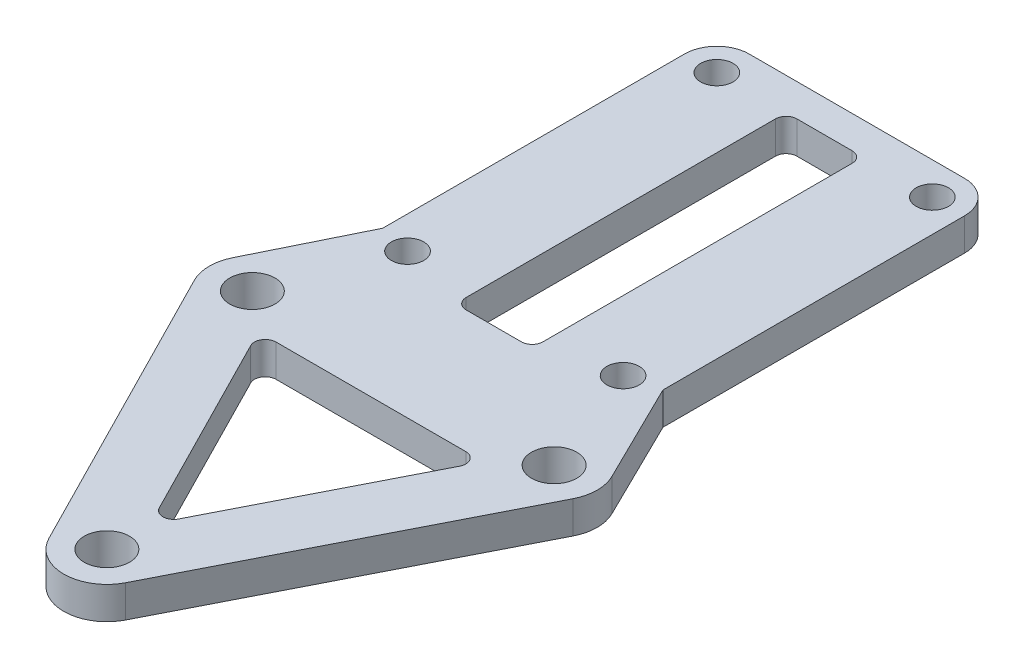
from build123d import *

# Parameters (mm, degrees)
SKETCH_1_R      = 2.1
SKETCH_1_R_2    = 1.5
EXTRUDE_1_DEPTH = 3


with BuildPart() as part:
    # 草图1 → 凸台-拉伸1 (new body)
    with BuildSketch(Plane(origin=(0, 0, 0), x_dir=(1, 0, 0), z_dir=(0, 1, 0))):
        with BuildLine():
            Line((-17.564652462, 25.685267837), (-3.564652462, -1.814732163))
            ThreePointArc((-3.564652462, -1.814732163), (0, -4), (3.564652462, -1.814732163))
            Line((3.564652462, -1.814732163), (17.564652462, 25.685267837))
            ThreePointArc((17.564652462, 25.685267837), (17.999904029, 27.472291527), (17.589451488, 29.265173649))
            Line((17.589451488, 29.265173649), (13, 38.597747519))
            Line((13, 38.597747519), (13, 66.6))
            ThreePointArc((13, 66.6), (12.121320344, 68.721320344), (10, 69.6))
            Line((10, 69.6), (-10, 69.6))
            ThreePointArc((-10, 69.6), (-12.121320344, 68.721320344), (-13, 66.6))
            Line((-13, 66.6), (-13, 38.597747519))
            Line((-13, 38.597747519), (-17.589451488, 29.265173649))
            ThreePointArc((-17.589451488, 29.265173649), (-17.999904029, 27.472291527), (-17.564652462, 25.685267837))
        make_face()
        with Locations((-14, 27.5)):
            Circle(SKETCH_1_R, mode=Mode.SUBTRACT)
        Circle(SKETCH_1_R, mode=Mode.SUBTRACT)
        with Locations((14, 27.5)):
            Circle(SKETCH_1_R, mode=Mode.SUBTRACT)
        with Locations((-10, 66.6)):
            Circle(SKETCH_1_R_2, mode=Mode.SUBTRACT)
        with Locations((10, 66.6)):
            Circle(SKETCH_1_R_2, mode=Mode.SUBTRACT)
        with Locations((-10, 37.9)):
            Circle(SKETCH_1_R_2, mode=Mode.SUBTRACT)
        with Locations((10, 37.9)):
            Circle(SKETCH_1_R_2, mode=Mode.SUBTRACT)
        with BuildLine():
            Line((-9.696306816, 23.046316959), (-0.891163116, 5.750498977))
            ThreePointArc((-0.891163116, 5.750498977), (0, 5.204182018), (0.891163116, 5.750498977))
            Line((0.891163116, 5.750498977), (9.696306816, 23.046316959))
            ThreePointArc((9.696306816, 23.046316959), (9.657693711, 24.022645654), (8.8051437, 24.5))
            Line((8.8051437, 24.5), (-8.8051437, 24.5))
            ThreePointArc((-8.8051437, 24.5), (-9.657693711, 24.022645654), (-9.696306816, 23.046316959))
        make_face(mode=Mode.SUBTRACT)
        with BuildLine():
            Line((-3.564652462, 65.6), (-3.564652462, 36.9))
            ThreePointArc((-3.564652462, 36.9), (-3.271759244, 36.192893219), (-2.564652462, 35.9))
            Line((-2.564652462, 35.9), (2.564652462, 35.9))
            ThreePointArc((2.564652462, 35.9), (3.271759244, 36.192893219), (3.564652462, 36.9))
            Line((3.564652462, 36.9), (3.564652462, 65.6))
            ThreePointArc((3.564652462, 65.6), (3.271759244, 66.307106781), (2.564652462, 66.6))
            Line((2.564652462, 66.6), (-2.564652462, 66.6))
            ThreePointArc((-2.564652462, 66.6), (-3.271759244, 66.307106781), (-3.564652462, 65.6))
        make_face(mode=Mode.SUBTRACT)
    extrude(amount=EXTRUDE_1_DEPTH)


solid = part.part
